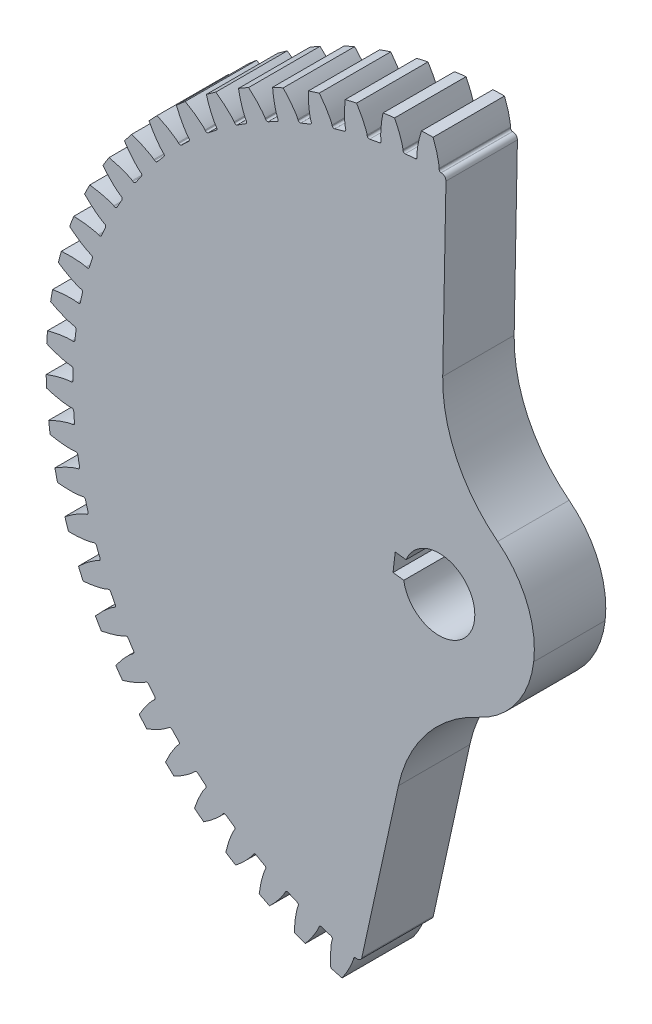
from build123d import *

# Parameters (mm, degrees)
SKETCH1_R           = 52.3875
BOSS_EXTRUDE1_DEPTH = 4.7625
CUT_EXTRUDE1_DEPTH  = 75.240027739
CIRPATTERN1_COUNT   = 64
SKETCH3_R           = 4.7625
CUT_EXTRUDE2_DEPTH  = 75.688352426
CUT_EXTRUDE3_DEPTH  = 75.688352426
FILLET1_R           = 12.7
FILLET2_R           = 19.05
CUT_EXTRUDE4_DEPTH  = 75.688352426
FILLET3_R           = 0.635


with BuildPart() as part:
    # Sketch1 → Boss-Extrude1 (new, symmetric)
    with BuildSketch(Plane.XY):
        with Locations(Location((0, 0, 0), (0, 0, 180))):
            Circle(SKETCH1_R)
    extrude(amount=BOSS_EXTRUDE1_DEPTH, both=True)

    # Sketch2 → Cut-Extrude1 (cut, symmetric)
    with BuildSketch(Plane.XY):
        with BuildLine():
            Line((49.181900131, 0), (49.079495166, 0))
            ThreePointArc((49.079495166, 0), (48.89291146, -0.07699106), (48.814915677, -0.263157008))
            ThreePointArc((48.814915677, -0.263157008), (48.806815111, -0.927384933), (48.789676769, -1.591441131))
            ThreePointArc((48.789676769, -1.591441131), (48.860544078, -1.780435647), (49.044068323, -1.864459178))
            Line((49.044068323, -1.864459178), (49.14639937, -1.868349395))
            add(Edge.make_bspline(
                [(49.14639937, -1.868349395), (49.162134131, -1.86916713), (49.20623058, -1.872139275), (49.289442522, -1.880437372), (49.424919873, -1.897777013), (49.597027958, -1.925447787), (49.818769372, -1.967603085), (50.07895268, -2.025464042), (50.363657808, -2.097620105), (50.671924501, -2.185339665), (50.978036979, -2.280978973), (51.281957587, -2.383920521), (51.583337077, -2.49324781), (51.946661159, -2.63365778), (52.379820965, -2.813096887), (52.882159566, -3.038866235), (53.446974678, -3.313770327), (54.016932736, -3.613929926), (54.572958534, -3.925660744), (55.128802559, -4.259263827), (55.662368844, -4.595242171), (56.209999544, -4.96307546), (56.712176864, -5.312217218), (57.267058728, -5.724002946), (57.712631477, -6.06236242), (58.166155463, -6.428907196), (58.385878103, -6.609809222), (58.497738736, -6.703312015)],
                knots=[0, 0, 0, 0, 0, 0.005376749, 0.015083688, 0.02853182, 0.04661014, 0.064854849, 0.092110526, 0.119476176, 0.146842496, 0.174208854, 0.201574956, 0.228941013, 0.256307345, 0.307035032, 0.361767352, 0.416499661, 0.471231937, 0.525964282, 0.580696616, 0.635428982, 0.690161387, 0.744893688, 0.799626082, 0.854358408, 0.909090915, 0.909090915, 0.909090915, 0.909090915, 0.909090915], degree=4))
            ThreePointArc((58.497738736, -6.703312015), (58.869929278, -1.118595535), (58.710162711, 4.476228735))
            add(Edge.make_bspline(
                [(49.181900131, 0), (49.197654599, 0.000219403), (49.241832125, 0.001514243), (49.325299236, 0.006645249), (49.461337503, 0.018825784), (49.63437253, 0.039938447), (49.857555304, 0.07363968), (50.119748859, 0.121574883), (50.406989584, 0.182863326), (50.718366102, 0.258808961), (51.027890818, 0.342750462), (51.33550265, 0.434072199), (51.640817783, 0.531871601), (52.00921358, 0.658378062), (52.448877353, 0.82123253), (52.959430005, 1.027755793), (53.534280628, 1.281004942), (54.115229906, 1.559295993), (54.682696553, 1.849679179), (55.250812456, 2.161925746), (55.796756931, 2.477392159), (56.357965793, 2.824156237), (56.87304402, 3.153968984), (57.443168501, 3.544378314), (57.901273412, 3.865566885), (58.36839454, 4.214618359), (58.594830785, 4.387042859), (58.710162711, 4.476228735)],
                knots=[0, 0, 0, 0, 0, 0.005376749, 0.015083688, 0.02853182, 0.04661014, 0.064854849, 0.092110526, 0.119476176, 0.146842496, 0.174208854, 0.201574956, 0.228941013, 0.256307345, 0.307035032, 0.361767352, 0.416499661, 0.471231937, 0.525964282, 0.580696616, 0.635428982, 0.690161387, 0.744893688, 0.799626082, 0.854358408, 0.909090915, 0.909090915, 0.909090915, 0.909090915, 0.909090915], degree=4))
        make_face()
    cut_extrude1 = extrude(amount=CUT_EXTRUDE1_DEPTH, both=True, mode=Mode.SUBTRACT)

    # CirPattern1: Cut-Extrude1 ×64 about axis
    cirpattern1_axis = Axis((0, 0, -5.23875), (0, 0, 1))
    for i in range(1, CIRPATTERN1_COUNT):
        add(cut_extrude1.rotate(cirpattern1_axis, i * 360 / CIRPATTERN1_COUNT), mode=Mode.SUBTRACT)

    # Sketch3 → Cut-Extrude2 (cut, through all)
    with BuildSketch(Plane.XY.offset(4.7625)):
        Circle(SKETCH3_R)
    extrude(amount=-CUT_EXTRUDE2_DEPTH, mode=Mode.SUBTRACT)

    # Sketch4 → Cut-Extrude3 (cut, through all)
    with BuildSketch(Plane.XY.offset(4.7625)):
        with BuildLine():
            Line((0.927384933, 48.806815111), (0.242438284, 12.759146776))
            Line((0.242438284, 12.759146776), (14.097618499, 11.128214262))
            Line((14.097618499, 11.128214262), (11.128214262, -14.097618499))
            Line((11.128214262, -14.097618499), (-2.726965953, -12.466685985))
            Line((-2.726965953, -12.466685985), (-10.431302769, -47.688082019))
            Line((-10.431302769, -47.688082019), (-12.2122569, -55.829949681))
            ThreePointArc((-12.2122569, -55.829949681), (56.758123712, -6.681159533), (1.085718947, 57.139685984))
            Line((1.085718947, 57.139685984), (0.927384933, 48.806815111))
        make_face()
    extrude(amount=-CUT_EXTRUDE3_DEPTH, mode=Mode.SUBTRACT)

    # Fillet1
    fillet1_edges = [part.edges().sort_by_distance(p)[0] for p in [
        (11.128214262, -14.097618499, 0),
        (14.097618499, 11.128214262, 0),
    ]]
    fillet(fillet1_edges, radius=FILLET1_R - 0.0001)  # a hair under: the kernel refuses the full size

    # Fillet2
    fillet2_edges = [part.edges().sort_by_distance(p)[0] for p in [
        (-2.726965953, -12.466685985, 0),
        (0.242438284, 12.759146776, 0),
    ]]
    fillet(fillet2_edges, radius=FILLET2_R)

    # Sketch5 → Cut-Extrude4 (cut, through all)
    with BuildSketch(Plane.XY.offset(4.7625)):
        Polygon((-5.847972677, 1.967149918), (-4.41010021, 1.797893876), (-4.707040633, -0.7246894), (-6.144913101, -0.555433358), align=None)
    extrude(amount=-CUT_EXTRUDE4_DEPTH, mode=Mode.SUBTRACT)

    # Fillet3
    fillet3_edges = [part.edges().sort_by_distance(p)[0] for p in [
        (0.927384933, 48.806815111, 0),
        (-10.431302769, -47.688082019, 0),
    ]]
    fillet(fillet3_edges, radius=FILLET3_R)


solid = part.part
